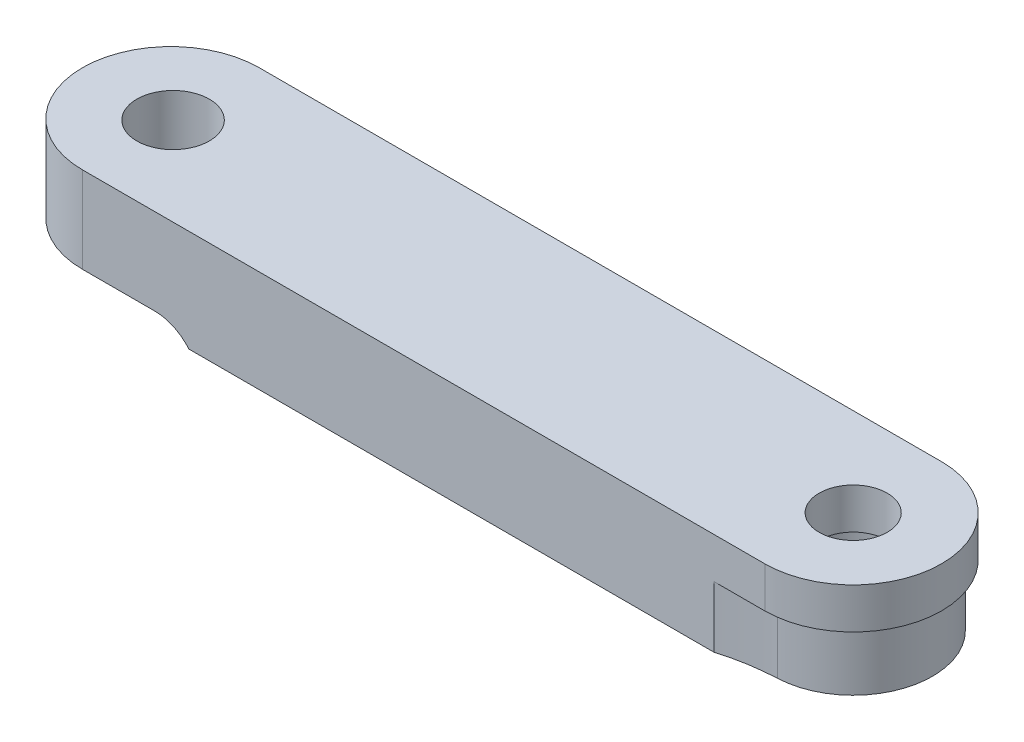
from build123d import *

# Parameters (mm, degrees)
SKETCH1_R              = 3.5
SKETCH1_R_2            = 2.25
BOSS_EXTRUDE1_DEPTH    = 2.7
SKETCH2_R              = 1.6
SKETCH2_R_2            = 1.5
BOSS_EXTRUDE2_DEPTH    = 1.8
BOSS_EXTRUDE3_DEPTH    = 3.9
FILLET1_R              = 10
CUT_EXTRUDE1_START     = -2
CUT_EXTRUDE1_OUTLINE_R = 1.6
CUT_EXTRUDE1_DEPTH     = 2
FILLET2_R              = 2


# Read off the part's stored shape, not the designer's step: Cut-Extrude1
with BuildPart() as part:
    # Sketch1 → Boss-Extrude1 (new body)
    with BuildSketch(Plane(origin=(0, 0, 0), x_dir=(1, 0, 0), z_dir=(0, 1, 0))):
        with Locations(Location((0, 0, 0), (0, 0, 90))):
            Circle(SKETCH1_R)
        with Locations(Location((0, 0, 0), (0, 0, 90))):
            Circle(SKETCH1_R_2, mode=Mode.SUBTRACT)
    extrude(amount=BOSS_EXTRUDE1_DEPTH)

    # Sketch2 → Boss-Extrude2 (add)
    with BuildSketch(Plane(origin=(0, 2.7, 0), x_dir=(1, 0, 0), z_dir=(0, 1, 0))):
        with BuildLine():
            Line((0, 3.9), (-30.1, 3.9))
            ThreePointArc((-30.1, 3.9), (-34, 0), (-30.1, -3.9))
            Line((-30.1, -3.9), (0, -3.9))
            ThreePointArc((0, -3.9), (3.9, 0), (0, 3.9))
        make_face()
        with Locations(Location((-30, 0, 0), (0, 0, 270))):
            Circle(SKETCH2_R, mode=Mode.SUBTRACT)
        with Locations(Location((0, 0, 0), (0, 0, 270))):
            Circle(SKETCH2_R_2, mode=Mode.SUBTRACT)
    extrude(amount=BOSS_EXTRUDE2_DEPTH)

    # Sketch3 → Boss-Extrude3 (add, symmetric)
    with BuildSketch(Plane.XY):
        Polygon((-25.4, 2.7), (-2.25, 2.7), (-2.25, 0), (-3.5, 0), (-25.4, 0), align=None)
        Polygon((-34, 0.7), (-25.4, 0.7), (-25.4, 2.7), (-28.4, 2.7), (-31.6, 2.7), (-34, 2.7), align=None)
    extrude(amount=BOSS_EXTRUDE3_DEPTH, both=True)

    # Fillet1
    # the kernel refuses this fillet: 10 mm, written as the material it adds along each edge
    with BuildSketch(Plane(origin=(-2.25, 2.7, -2.680951324), x_dir=(0.9469829588957737, 0, -0.3212837928701128), z_dir=(0, -1, 0))) as fillet1_piece_1:
        with BuildLine():
            CenterArc((6.165489318, -9.319153575), FILLET1_R, 111.264619874, 14.002057775)
            Line((0.391660582, -1.154418323), (0.276184008, -0.991123617))
            ThreePointArc((0.276184008, -0.991123617), (0.006433699, -0.64146592), (-0.189396592, -0.064256759))
            Line((-0.189396592, -0.064256759), (0.072535168, 0.186383071))
            ThreePointArc((0.072535168, 0.186383071), (1.269365448, -0.038296249), (2.466195727, 0.186383071))
            Line((2.466195727, 0.186383071), (2.538730895, 0))
        make_face()
    extrude(amount=2.7)
    with BuildSketch(Plane(origin=(-2.25, 2.7, 2.680951324), x_dir=(1.3741079680414238e-12, 0, 1.0), z_dir=(0, -1, 0))) as fillet1_piece_2:
        with BuildLine():
            CenterArc((10.805951419, -2.84452031), FILLET1_R, 163.473903362, 14.002057775)
            Line((0.815653091, -2.404134895), (0.615847125, -2.395327187))
            ThreePointArc((0.615847125, -2.395327187), (0.444092441, -1.189763484), (-0.153197218, -0.128571429))
            Line((-0.153197218, -0.128571429), (0, 0.2))
            ThreePointArc((0, 0.2), (0.609524338, 0.2), (1.027310621, 0.056890406))
            Line((1.027310621, 0.056890406), (1.219048676, 0))
        make_face()
    extrude(amount=2.7)

    # Cut-Extrude1 outline → Cut-Extrude1 (cut)
    with BuildSketch(Plane(origin=(0, 2.7, 0), x_dir=(1, 0, 0), z_dir=(0, 1, 0)).offset(CUT_EXTRUDE1_START)):
        with BuildLine():
            Line((-34, -3.9), (-30.1, -3.9))
            ThreePointArc((-30.1, -3.9), (-32.857716447, -2.757716447), (-34, 0))
            Line((-34, 0), (-34, -3.9))
        make_face()
        with BuildLine():
            Line((-34, 3.9), (-34, 0))
            ThreePointArc((-34, 0), (-32.857716447, 2.757716447), (-30.1, 3.9))
            Line((-30.1, 3.9), (-34, 3.9))
        make_face()
        with Locations((-30, 0)):
            Circle(CUT_EXTRUDE1_OUTLINE_R)
    extrude(amount=CUT_EXTRUDE1_DEPTH, mode=Mode.SUBTRACT)

    # Fillet2
    # the kernel refuses this fillet: 2 mm, written as the material it adds along each edge
    with BuildSketch(Plane(origin=(-25.4, 0.7, -3.9), x_dir=(-1, 0, 0), z_dir=(0, 0, 1))) as fillet2_piece_1:
        with BuildLine():
            CenterArc((1.519868415, 2), FILLET2_R, 220.541601874, 49.458398126)
            Line((0, 0.7), (-0.030397368, 0.674))
            ThreePointArc((-0.030397368, 0.674), (-0.04, 0.35), (-0.04, 0))
            Line((-0.04, 0), (0, -0.04))
            Line((0, -0.04), (1.519868415, -0.04))
            Line((1.519868415, -0.04), (1.519868415, 0))
        make_face()
    extrude(amount=7.8)


solid = part.part
